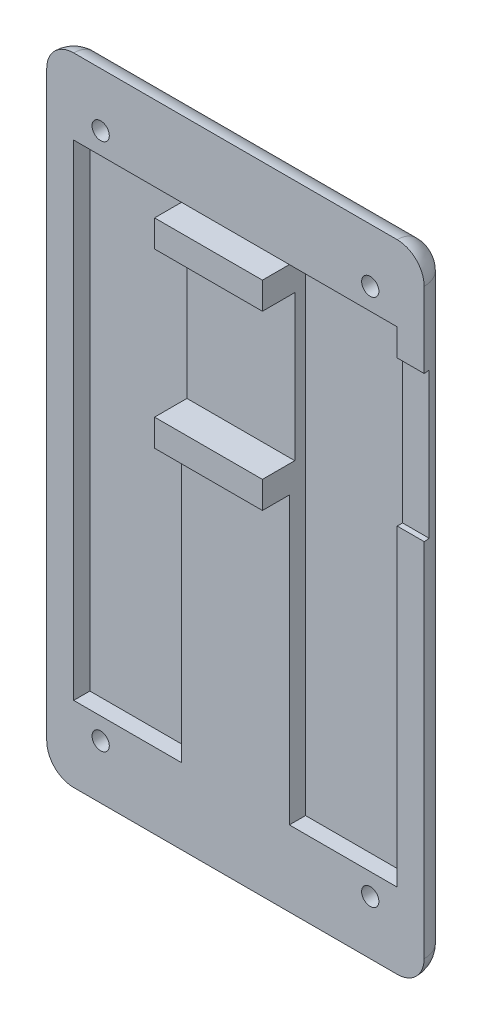
from build123d import *

# Parameters (mm, degrees)
SKETCH_1_W          = 70
SKETCH_1_H          = 118
EXTRUDE_1_DEPTH     = 40
SKETCH_2_W          = 64
SKETCH_2_H          = 112
CUT_EXTRUDE_1_DEPTH = 35
SKETCH_3_R          = 1.6
CUT_EXTRUDE_2_DEPTH = 78.012985918
FILLET_1_R          = 5
FILLET_2_R          = 5
SKETCH_4_W          = 80
SKETCH_4_H          = 120
CUT_EXTRUDE_3_DEPTH = 35
SKETCH_5_W          = 60
SKETCH_5_H          = 27
CUT_EXTRUDE_4_DEPTH = 1
SKETCH_6_W          = 20
SKETCH_6_H          = 90
CUT_EXTRUDE_5_DEPTH = 3
SKETCH_7_W          = 20
SKETCH_7_H          = 90
CUT_EXTRUDE_6_DEPTH = 3
SKETCH_8_W          = 20
SKETCH_8_H          = 5
EXTRUDE_2_DEPTH     = 5


with BuildPart() as part:
    # ｽｹｯﾁ1 → ﾎﾞｽ - 押し出し1 (new body)
    with BuildSketch(Plane.XY):
        Rectangle(SKETCH_1_W, SKETCH_1_H)
    extrude(amount=EXTRUDE_1_DEPTH)

    # ｽｹｯﾁ2 → ｶｯﾄ - 押し出し1 (cut)
    with BuildSketch(Plane.XY.offset(40)):
        Rectangle(SKETCH_2_W, SKETCH_2_H)
    extrude(amount=-CUT_EXTRUDE_1_DEPTH, mode=Mode.SUBTRACT)

    # ｽｹｯﾁ3 → ｶｯﾄ - 押し出し2 (cut, through all)
    with BuildSketch(Plane.XY.offset(5)):
        with Locations((-25, 49)):
            Circle(SKETCH_3_R)
        with Locations((25, 49)):
            Circle(SKETCH_3_R)
        with Locations((-25, -49)):
            Circle(SKETCH_3_R)
        with Locations((25, -49)):
            Circle(SKETCH_3_R)
    extrude(amount=-CUT_EXTRUDE_2_DEPTH, mode=Mode.SUBTRACT)

    # ﾌｨﾚｯﾄ1
    fillet_1_edges = [part.edges().sort_by_distance(p)[0] for p in [
        (0, -59, 0),
        (-35, 0, 0),
        (0, 59, 0),
        (35, 0, 0),
    ]]
    fillet(fillet_1_edges, radius=FILLET_1_R)

    # ﾌｨﾚｯﾄ2
    # the kernel refuses this fillet: 5 mm, written as the material it takes off along each edge
    with BuildSketch(Plane(origin=(-30, 54, 5), x_dir=(0, 1, 0), z_dir=(-1, 0, 0))) as fillet_2_piece_1_section:
        Polygon((0, 0), (FILLET_2_R, 0), (FILLET_2_R, FILLET_2_R), (0, FILLET_2_R), align=None)
    fillet_2_piece_1 = extrude(amount=FILLET_2_R, mode=Mode.PRIVATE)
    fillet_2_piece_1 = fillet_2_piece_1 - Plane(origin=(-30, 54, 5), x_dir=(0, -0.7071067811865475, 0.7071067811865475), z_dir=(-1, 0, 0)) * Sphere(FILLET_2_R, mode=Mode.PRIVATE)
    add(fillet_2_piece_1, mode=Mode.SUBTRACT)
    with BuildSketch(Plane(origin=(30, 54, 5), x_dir=(0, 1, 0), z_dir=(1, 0, 0))) as fillet_2_piece_2_section:
        Polygon((0, 0), (FILLET_2_R, 0), (FILLET_2_R, -FILLET_2_R), (0, -FILLET_2_R), align=None)
    fillet_2_piece_2 = extrude(amount=FILLET_2_R, mode=Mode.PRIVATE)
    fillet_2_piece_2 = fillet_2_piece_2 - Plane(origin=(30, 54, 5), x_dir=(0, -0.7071067811865475, 0.7071067811865475), z_dir=(1, 0, 0)) * Sphere(FILLET_2_R, mode=Mode.PRIVATE)
    add(fillet_2_piece_2, mode=Mode.SUBTRACT)
    with BuildSketch(Plane(origin=(-30, -54, 5), x_dir=(-1, 0, 0), z_dir=(0, -1, 0))) as fillet_2_piece_3_section:
        Polygon((0, 0), (FILLET_2_R, 0), (FILLET_2_R, FILLET_2_R), (0, FILLET_2_R), align=None)
    fillet_2_piece_3 = extrude(amount=FILLET_2_R, mode=Mode.PRIVATE)
    fillet_2_piece_3 = fillet_2_piece_3 - Plane(origin=(-30, -54, 5), x_dir=(0.7071067811865475, 0, 0.7071067811865475), z_dir=(0, -1, 0)) * Sphere(FILLET_2_R, mode=Mode.PRIVATE)
    add(fillet_2_piece_3, mode=Mode.SUBTRACT)
    with BuildSketch(Plane(origin=(30, -54, 5), x_dir=(1, 0, 0), z_dir=(0, -1, 0))) as fillet_2_piece_4_section:
        Polygon((0, 0), (FILLET_2_R, 0), (FILLET_2_R, -FILLET_2_R), (0, -FILLET_2_R), align=None)
    fillet_2_piece_4 = extrude(amount=FILLET_2_R, mode=Mode.PRIVATE)
    fillet_2_piece_4 = fillet_2_piece_4 - Plane(origin=(30, -54, 5), x_dir=(-0.7071067811865475, 0, 0.7071067811865475), z_dir=(0, -1, 0)) * Sphere(FILLET_2_R, mode=Mode.PRIVATE)
    add(fillet_2_piece_4, mode=Mode.SUBTRACT)
    with BuildSketch(Plane(origin=(35, -59, 5), x_dir=(-1, 0, 0), z_dir=(0, 0, 1)), Plane(origin=(35, 59, 5), x_dir=(0, -1, 0), z_dir=(0, 0, 1))) as fillet_2_piece_5:
        with BuildLine():
            CenterArc((FILLET_2_R, -FILLET_2_R), FILLET_2_R, 90, 90)
            Line((0, -FILLET_2_R), (0, 0))
            Line((0, 0), (FILLET_2_R, 0))
        make_face()
    extrude(amount=47.5, mode=Mode.SUBTRACT)
    with BuildSketch(Plane(origin=(-35, -59, 5), x_dir=(1, 0, 0), z_dir=(0, 0, 1)), Plane(origin=(-35, 59, 5), x_dir=(0, -1, 0), z_dir=(0, 0, 1))) as fillet_2_piece_6:
        with BuildLine():
            CenterArc((FILLET_2_R, FILLET_2_R), FILLET_2_R, 180, 90)
            Line((0, FILLET_2_R), (0, 0))
            Line((0, 0), (FILLET_2_R, 0))
        make_face()
    extrude(amount=47.5, mode=Mode.SUBTRACT)

    # ｽｹｯﾁ4 → ｶｯﾄ - 押し出し3 (cut)
    with BuildSketch(Plane.XY.offset(40)):
        Rectangle(SKETCH_4_W, SKETCH_4_H)
    extrude(amount=-CUT_EXTRUDE_3_DEPTH, mode=Mode.SUBTRACT)

    # ｽｹｯﾁ5 → ｶｯﾄ - 押し出し4 (cut)
    with BuildSketch(Plane.XY.offset(5)):
        with Locations((5, 26.5)):
            Rectangle(SKETCH_5_W, SKETCH_5_H)
    extrude(amount=-CUT_EXTRUDE_4_DEPTH, mode=Mode.SUBTRACT)

    # ｽｹｯﾁ6 → ｶｯﾄ - 押し出し5 (cut)
    with BuildSketch(Plane.XY.offset(5)):
        with Locations((-20, 0)):
            Rectangle(SKETCH_6_W, SKETCH_6_H)
    extrude(amount=-CUT_EXTRUDE_5_DEPTH, mode=Mode.SUBTRACT)

    # ｽｹｯﾁ7 → ｶｯﾄ - 押し出し6 (cut)
    with BuildSketch(Plane.XY.offset(5)):
        with Locations((20, 0)):
            Rectangle(SKETCH_7_W, SKETCH_7_H)
    extrude(amount=-CUT_EXTRUDE_6_DEPTH, mode=Mode.SUBTRACT)

    # ｽｹｯﾁ8 → ﾎﾞｽ - 押し出し2 (add)
    with BuildSketch(Plane.XY.offset(5)):
        with Locations((0, 10.5)):
            Rectangle(SKETCH_8_W, SKETCH_8_H)
        with Locations((0, 42.5)):
            Rectangle(SKETCH_8_W, SKETCH_8_H)
    extrude(amount=EXTRUDE_2_DEPTH)


solid = part.part
